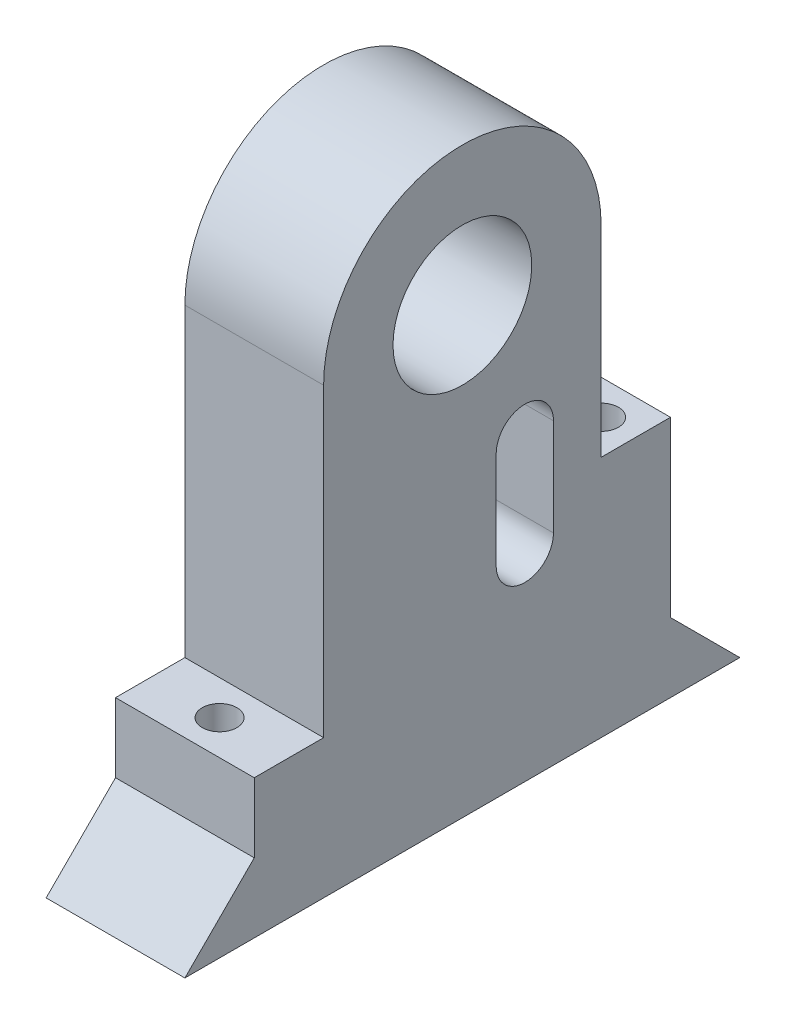
from build123d import *

# Parameters (mm, degrees)
BOSS_EXTRUDE1_DEPTH        = 10
F_10_0MM_DOWEL_HOLE1_D     = 10
F_10_0MM_DOWEL_HOLE1_DEPTH = 25
F_10_0MM_DOWEL_HOLE1_TIP   = 3.004303095
CUT_EXTRUDE1_DEPTH         = 10
M3_TAPPED_HOLE1_AT_2_COUNT = 2
M3_TAPPED_HOLE1_AT_2_PITCH = 25.124689053
M3_TAPPED_HOLE3_D          = 2.5
M3_TAPPED_HOLE3_DEPTH      = 27.5
M3_TAPPED_HOLE3_TIP        = 0.751075774
M3_TAPPED_HOLE4_D          = 2.5
M3_TAPPED_HOLE4_DEPTH      = 27.5
M3_TAPPED_HOLE4_TIP        = 0.751075774


with BuildPart() as part:
    # Sketch1 → Boss-Extrude1 (new body)
    with BuildSketch(Plane(origin=(0, 0, 0), x_dir=(0, 0, -1), z_dir=(1, 0, 0))):
        with BuildLine():
            Line((10, 0), (-10, 0))
            Line((-10, 0), (-20, 0))
            Line((-20, 0), (-15, 5))
            Line((-15, 5), (-15, 10))
            Line((-15, 10), (-10, 10))
            Line((-10, 10), (-10, 32))
            ThreePointArc((-10, 32), (0, 42), (10, 32))
            Line((10, 32), (10, 17.5))
            Line((10, 17.5), (15, 17.5))
            Line((15, 17.5), (15, 10))
            Line((15, 10), (15, 5))
            Line((15, 5), (20, 0))
            Line((20, 0), (10, 0))
        make_face()
    extrude(amount=BOSS_EXTRUDE1_DEPTH)

    # Ø10.0mm Dowel Hole1
    with Locations(Plane(origin=(0, 32, 0), x_dir=(0, 0, -1), z_dir=(-1, 0, 0))):
        with Locations((0, 0)):
            Hole(F_10_0MM_DOWEL_HOLE1_D / 2, depth=F_10_0MM_DOWEL_HOLE1_DEPTH)
            with Locations((0, 0, -(F_10_0MM_DOWEL_HOLE1_DEPTH + F_10_0MM_DOWEL_HOLE1_TIP / 2))):  # 118° drill point
                Cone(0, F_10_0MM_DOWEL_HOLE1_D / 2, F_10_0MM_DOWEL_HOLE1_TIP, mode=Mode.SUBTRACT)

    # Sketch5 → Cut-Extrude1 (cut)
    with BuildSketch(Plane(origin=(10, 0, 0), x_dir=(0, 0, -1), z_dir=(1, 0, 0))):
        with BuildLine():
            Line((6.563643286, 21.5), (6.563643286, 14.5))
            ThreePointArc((6.563643286, 14.5), (4.5, 12.436356714), (2.436356714, 14.5))
            Line((2.436356714, 14.5), (2.436356714, 21.5))
            ThreePointArc((2.436356714, 21.5), (4.5, 23.563643286), (6.563643286, 21.5))
        make_face()
    extrude(amount=-CUT_EXTRUDE1_DEPTH, mode=Mode.SUBTRACT)

    # Sketch9 → M3 Tapped Hole1 (revolve, cut)
    with BuildSketch(Plane(origin=(5, 10, 12.5), x_dir=(0, 0, 1), z_dir=(1, 0, 0))):
        Polygon((0, 0), (0, 18.251075774), (1.25, 17.5), (1.25, 0), align=None)
    m3_tapped_hole1 = revolve(axis=Axis((5, 16.35, 12.5), (0, -1, 0)), mode=Mode.SUBTRACT)

    # M3 Tapped Hole1 at 2: M3 Tapped Hole1 ×2
    with Locations(*[Vector(-0.09950371902099822, -4.489554440449259e-15, -0.9950371902099893) * (i * M3_TAPPED_HOLE1_AT_2_PITCH) for i in range(1, M3_TAPPED_HOLE1_AT_2_COUNT)]):
        add(m3_tapped_hole1, mode=Mode.SUBTRACT)

    # M3 Tapped Hole3
    with Locations(Plane(origin=(0, 17.5, 0), x_dir=(1, 0, 0), z_dir=(0, 1, 0))):
        with Locations((7.5, 12.5)):
            Hole(M3_TAPPED_HOLE3_D / 2, depth=M3_TAPPED_HOLE3_DEPTH)
            with Locations((0, 0, -(M3_TAPPED_HOLE3_DEPTH + M3_TAPPED_HOLE3_TIP / 2))):  # 118° drill point
                Cone(0, M3_TAPPED_HOLE3_D / 2, M3_TAPPED_HOLE3_TIP, mode=Mode.SUBTRACT)

    # M3 Tapped Hole4
    with Locations(Plane(origin=(0, 17.5, 0), x_dir=(1, 0, 0), z_dir=(0, 1, 0))):
        with Locations((2.5, 12.5)):
            Hole(M3_TAPPED_HOLE4_D / 2, depth=M3_TAPPED_HOLE4_DEPTH)
            with Locations((0, 0, -(M3_TAPPED_HOLE4_DEPTH + M3_TAPPED_HOLE4_TIP / 2))):  # 118° drill point
                Cone(0, M3_TAPPED_HOLE4_D / 2, M3_TAPPED_HOLE4_TIP, mode=Mode.SUBTRACT)


solid = part.part
